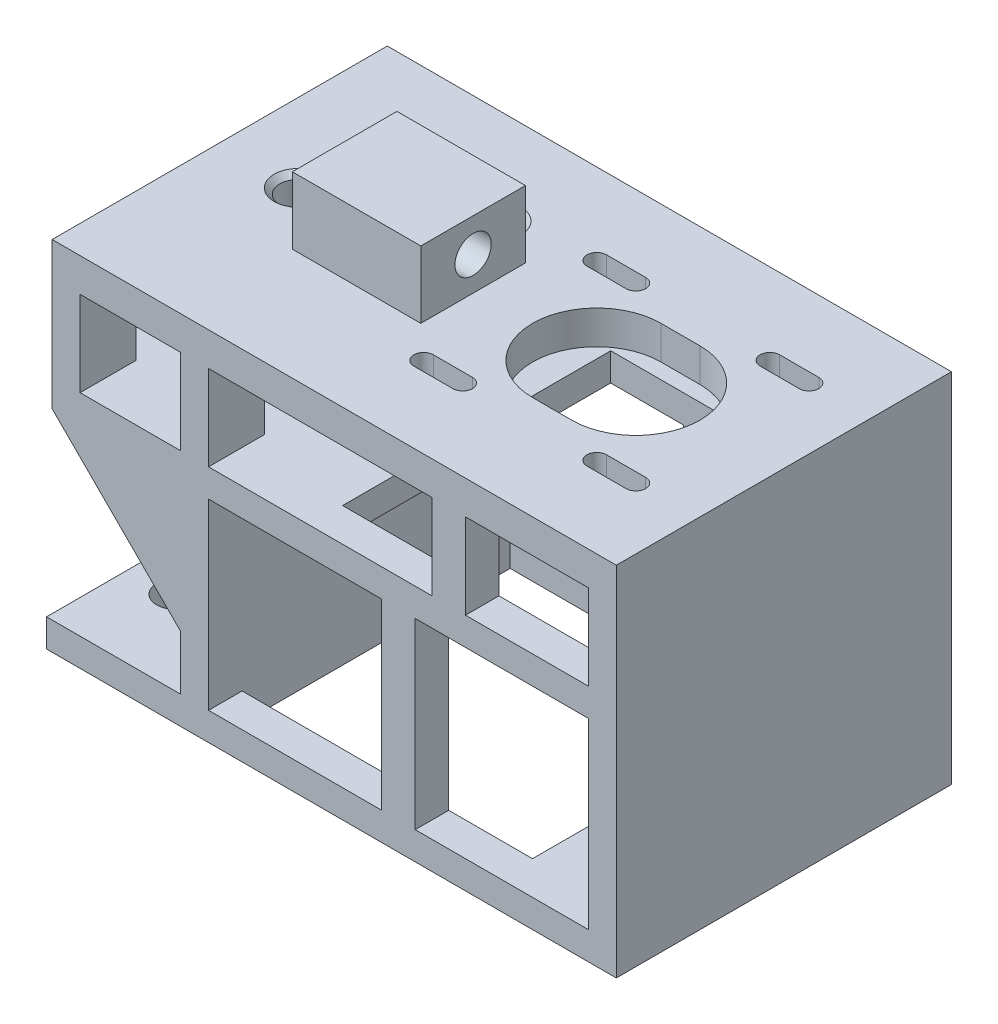
from build123d import *

# Parameters (mm, degrees)
SKETCH1_W           = 68
SKETCH1_H           = 15.25
SKETCH1_W_2         = 18
BOSS_EXTRUDE1_DEPTH = 60
SKETCH2_W           = 40
SKETCH2_H           = 15.25
CUT_EXTRUDE1_DEPTH  = 122.264174429
CUT_EXTRUDE2_REACH  = 116.127
CUT_EXTRUDE3_REACH  = 123.264
SKETCH5_R           = 3.25
CUT_EXTRUDE4_REACH  = 105.714
SKETCH6_R           = 2.75
SKETCH7_R           = 2.75
CUT_EXTRUDE5_DEPTH  = 115.127122105
CUT_EXTRUDE6_REACH  = 116.127
SKETCH8_R           = 3.25
SKETCH9_W           = 23
SKETCH9_H           = 21.27
SKETCH9_H_2         = 20
CUT_EXTRUDE7_DEPTH  = 12
CHAMFER1_SIZE       = 1
CUT_EXTRUDE8_REACH  = 123.264
SKETCH10_R          = 3.3
SKETCH10_R_2        = 2.75
SKETCH11_R          = 3.25
CUT_EXTRUDE9_DEPTH  = 125.338248339
CHAMFER2_SIZE       = 1
SKETCH12_W          = 50
SKETCH12_H          = 48
CUT_EXTRUDE10_DEPTH = 5
SKETCH13_W          = 52
SKETCH13_H          = 6
BOSS_EXTRUDE2_DEPTH = 5
SKETCH14_W          = 6
SKETCH14_H          = 32.75
BOSS_EXTRUDE3_DEPTH = 6
SKETCH15_W          = 6
SKETCH15_H          = 15.25
BOSS_EXTRUDE4_DEPTH = 6
BOSS_EXTRUDE5_DEPTH = 10


with BuildPart() as part:
    # Sketch1 → Boss-Extrude1 (new body)
    with BuildSketch(Plane.XY):
        Polygon((0, 0), (-29, 0), (-29, 5), (-5, 5), (-5, 37.75), (-28, 37.75), (-28, 64), (-5, 64), (-5, 76), (18, 76), (18, 64), (73, 64), (73, 0), (52, 0), (52, 5), (68, 5), (68, 37.75), (0, 37.75), align=None)
        with Locations((34, 50.375)):
            Rectangle(SKETCH1_W, SKETCH1_H, mode=Mode.SUBTRACT)
        with Locations((-14, 50.375)):
            Rectangle(SKETCH1_W_2, SKETCH1_H, mode=Mode.SUBTRACT)
    extrude(amount=BOSS_EXTRUDE1_DEPTH)

    # Sketch2 → Cut-Extrude1 (cut, through all)
    with BuildSketch(Plane(origin=(0, 0, 0), x_dir=(0, 0, -1), z_dir=(1, 0, 0))):
        with Locations((-30, 50.375)):
            Rectangle(SKETCH2_W, SKETCH2_H)
    extrude(amount=-CUT_EXTRUDE1_DEPTH, mode=Mode.SUBTRACT)

    # Sketch3 → Cut-Extrude2 (cut, up to next)
    with BuildSketch(Plane(origin=(0, 64, 0), x_dir=(1, 0, 0), z_dir=(0, 1, 0)), mode=Mode.PRIVATE) as cut_extrude2_sk1:
        with BuildLine():
            Line((39.5, -18.5), (46.5, -18.5))
            ThreePointArc((46.5, -18.5), (58, -30), (46.5, -41.5))
            Line((46.5, -41.5), (39.5, -41.5))
            ThreePointArc((39.5, -41.5), (28, -30), (39.5, -18.5))
        make_face()
    cut_extrude2_tool1 = extrude(cut_extrude2_sk1.sketch, amount=-CUT_EXTRUDE2_REACH, mode=Mode.PRIVATE) & part.part
    # Sketch3 → Cut-Extrude2 (cut, up to next)
    with BuildSketch(Plane(origin=(0, 64, 0), x_dir=(1, 0, 0), z_dir=(0, 1, 0)), mode=Mode.PRIVATE) as cut_extrude2_sk2:
        with BuildLine():
            Line((31, -16.25), (24, -16.25))
            ThreePointArc((24, -16.25), (22.25, -14.5), (24, -12.75))
            Line((24, -12.75), (31, -12.75))
            ThreePointArc((31, -12.75), (32.75, -14.5), (31, -16.25))
        make_face()
    cut_extrude2_tool2 = extrude(cut_extrude2_sk2.sketch, amount=-CUT_EXTRUDE2_REACH, mode=Mode.PRIVATE) & part.part
    # Sketch3 → Cut-Extrude2 (cut, up to next)
    with BuildSketch(Plane(origin=(0, 64, 0), x_dir=(1, 0, 0), z_dir=(0, 1, 0)), mode=Mode.PRIVATE) as cut_extrude2_sk3:
        with BuildLine():
            Line((55, -16.25), (62, -16.25))
            ThreePointArc((62, -16.25), (63.75, -14.5), (62, -12.75))
            Line((62, -12.75), (55, -12.75))
            ThreePointArc((55, -12.75), (53.25, -14.5), (55, -16.25))
        make_face()
    cut_extrude2_tool3 = extrude(cut_extrude2_sk3.sketch, amount=-CUT_EXTRUDE2_REACH, mode=Mode.PRIVATE) & part.part
    # Sketch3 → Cut-Extrude2 (cut, up to next)
    with BuildSketch(Plane(origin=(0, 64, 0), x_dir=(1, 0, 0), z_dir=(0, 1, 0)), mode=Mode.PRIVATE) as cut_extrude2_sk4:
        with BuildLine():
            Line((31, -43.75), (24, -43.75))
            ThreePointArc((24, -43.75), (22.25, -45.5), (24, -47.25))
            Line((24, -47.25), (31, -47.25))
            ThreePointArc((31, -47.25), (32.75, -45.5), (31, -43.75))
        make_face()
    cut_extrude2_tool4 = extrude(cut_extrude2_sk4.sketch, amount=-CUT_EXTRUDE2_REACH, mode=Mode.PRIVATE) & part.part
    # Sketch3 → Cut-Extrude2 (cut, up to next)
    with BuildSketch(Plane(origin=(0, 64, 0), x_dir=(1, 0, 0), z_dir=(0, 1, 0)), mode=Mode.PRIVATE) as cut_extrude2_sk5:
        with BuildLine():
            Line((55, -43.75), (62, -43.75))
            ThreePointArc((62, -43.75), (63.75, -45.5), (62, -47.25))
            Line((62, -47.25), (55, -47.25))
            ThreePointArc((55, -47.25), (53.25, -45.5), (55, -43.75))
        make_face()
    cut_extrude2_tool5 = extrude(cut_extrude2_sk5.sketch, amount=-CUT_EXTRUDE2_REACH, mode=Mode.PRIVATE) & part.part
    add(cut_extrude2_tool1.solids().sort_by_distance((43, 64, 30))[0], mode=Mode.SUBTRACT)
    add(cut_extrude2_tool2.solids().sort_by_distance((27.5, 64, 14.5))[0], mode=Mode.SUBTRACT)
    add(cut_extrude2_tool3.solids().sort_by_distance((58.5, 64, 14.5))[0], mode=Mode.SUBTRACT)
    add(cut_extrude2_tool4.solids().sort_by_distance((27.5, 64, 45.5))[0], mode=Mode.SUBTRACT)
    add(cut_extrude2_tool5.solids().sort_by_distance((58.5, 64, 45.5))[0], mode=Mode.SUBTRACT)

    # Sketch5 → Cut-Extrude3 (cut, up to next)
    with BuildSketch(Plane(origin=(0, 76, 0), x_dir=(1, 0, 0), z_dir=(0, 1, 0)), mode=Mode.PRIVATE) as cut_extrude3_sk1:
        with Locations(Location((9, -17.27, 0), (0, 0, 180))):
            Circle(SKETCH5_R)
    cut_extrude3_tool1 = extrude(cut_extrude3_sk1.sketch, amount=-CUT_EXTRUDE3_REACH, mode=Mode.PRIVATE) & part.part
    add(cut_extrude3_tool1.solids().sort_by_distance((9, 76, 17.27))[0], mode=Mode.SUBTRACT)

    # Sketch6 → Cut-Extrude4 (cut, up to next)
    with BuildSketch(Plane(origin=(0, 42.75, 0), x_dir=(1, 0, 0), z_dir=(0, 1, 0)), mode=Mode.PRIVATE) as cut_extrude4_sk1:
        with Locations(Location((9, -17.27, 0), (0, 0, 270))):
            Circle(SKETCH6_R)
    cut_extrude4_tool1 = extrude(cut_extrude4_sk1.sketch, amount=-CUT_EXTRUDE4_REACH, mode=Mode.PRIVATE) & part.part
    add(cut_extrude4_tool1.solids().sort_by_distance((9, 42.75, 17.27))[0], mode=Mode.SUBTRACT)

    # Sketch7 → Cut-Extrude5 (cut, through all)
    with BuildSketch(Plane(origin=(0, 64, 0), x_dir=(1, 0, 0), z_dir=(0, 1, 0))):
        with Locations(Location((-14, -30, 0), (0, 0, 270))):
            Circle(SKETCH7_R)
    extrude(amount=-CUT_EXTRUDE5_DEPTH, mode=Mode.SUBTRACT)

    # Sketch8 → Cut-Extrude6 (cut, up to next)
    with BuildSketch(Plane(origin=(0, 64, 0), x_dir=(1, 0, 0), z_dir=(0, 1, 0)), mode=Mode.PRIVATE) as cut_extrude6_sk1:
        with Locations(Location((-14, -30, 0), (0, 0, 270))):
            Circle(SKETCH8_R)
    cut_extrude6_tool1 = extrude(cut_extrude6_sk1.sketch, amount=-CUT_EXTRUDE6_REACH, mode=Mode.PRIVATE) & part.part
    add(cut_extrude6_tool1.solids().sort_by_distance((-14, 64, 30))[0], mode=Mode.SUBTRACT)

    # Sketch9 → Cut-Extrude7 (cut)
    with BuildSketch(Plane(origin=(0, 76, 0), x_dir=(1, 0, 0), z_dir=(0, 1, 0))):
        with Locations((6.5, -10.635)):
            Rectangle(SKETCH9_W, SKETCH9_H)
        with Locations((6.5, -50)):
            Rectangle(SKETCH9_W, SKETCH9_H_2)
    extrude(amount=-CUT_EXTRUDE7_DEPTH, mode=Mode.SUBTRACT)

    # Chamfer1
    # the kernel refuses this chamfer: 1 mm, written as the material it takes off along each edge
    with BuildSketch(Plane(origin=(-14, 64, 30), x_dir=(0, 0, 1), z_dir=(-1, 0, 0))) as chamfer1_piece_1:
        Polygon((3.25 + CHAMFER1_SIZE, 0), (3.25, -CHAMFER1_SIZE), (3.25, 0), align=None)
    revolve(axis=Axis((-14, 64, 30), (0, 1, 0)), mode=Mode.SUBTRACT)
    with BuildSketch(Plane(origin=(9, 64, 17.27), x_dir=(-1, 0, 0), z_dir=(0, 0, -1))) as chamfer1_piece_2_section:
        Polygon((3.25 + CHAMFER1_SIZE, 0), (3.25, -CHAMFER1_SIZE), (3.25, 0), align=None)
    chamfer1_piece_2 = revolve(axis=Axis((9, 64, 17.27), (0, 1, 0)), mode=Mode.PRIVATE)
    chamfer1_piece_2 = split(chamfer1_piece_2, bisect_by=Plane(origin=(12.733674615, 63.516325385, 21.27), z_dir=(0, 0, -1)), keep=Keep.TOP, mode=Mode.PRIVATE)
    add(chamfer1_piece_2, mode=Mode.SUBTRACT)

    # Sketch10 → Cut-Extrude8 (cut, up to next)
    with BuildSketch(Plane.XZ, mode=Mode.PRIVATE) as cut_extrude8_sk1:
        with Locations((-21, 45)):
            Circle(SKETCH10_R)
    cut_extrude8_tool1 = extrude(cut_extrude8_sk1.sketch, amount=-CUT_EXTRUDE8_REACH, mode=Mode.PRIVATE) & part.part
    # Sketch10 → Cut-Extrude8 (cut, up to next)
    with BuildSketch(Plane.XZ, mode=Mode.PRIVATE) as cut_extrude8_sk2:
        with Locations((-21, 15)):
            Circle(SKETCH10_R)
    cut_extrude8_tool2 = extrude(cut_extrude8_sk2.sketch, amount=-CUT_EXTRUDE8_REACH, mode=Mode.PRIVATE) & part.part
    # Sketch10 → Cut-Extrude8 (cut, up to next)
    with BuildSketch(Plane.XZ, mode=Mode.PRIVATE) as cut_extrude8_sk3:
        with Locations((60, 15)):
            Circle(SKETCH10_R_2)
    cut_extrude8_tool3 = extrude(cut_extrude8_sk3.sketch, amount=-CUT_EXTRUDE8_REACH, mode=Mode.PRIVATE) & part.part
    # Sketch10 → Cut-Extrude8 (cut, up to next)
    with BuildSketch(Plane.XZ, mode=Mode.PRIVATE) as cut_extrude8_sk4:
        with Locations((60, 45)):
            Circle(SKETCH10_R_2)
    cut_extrude8_tool4 = extrude(cut_extrude8_sk4.sketch, amount=-CUT_EXTRUDE8_REACH, mode=Mode.PRIVATE) & part.part
    add(cut_extrude8_tool1.solids().sort_by_distance((-21, 0, 45))[0], mode=Mode.SUBTRACT)
    add(cut_extrude8_tool2.solids().sort_by_distance((-21, 0, 15))[0], mode=Mode.SUBTRACT)
    add(cut_extrude8_tool3.solids().sort_by_distance((60, 0, 15))[0], mode=Mode.SUBTRACT)
    add(cut_extrude8_tool4.solids().sort_by_distance((60, 0, 45))[0], mode=Mode.SUBTRACT)

    # Sketch11 → Cut-Extrude9 (cut, through all)
    with BuildSketch(Plane.ZY.offset(5)):
        with Locations(Location((30.635, 70, 0), (0, 0, 270))):
            Circle(SKETCH11_R)
    extrude(amount=-CUT_EXTRUDE9_DEPTH, mode=Mode.SUBTRACT)

    # Chamfer2
    chamfer2_edges = [part.edges().sort_by_distance(p)[0] for p in [
        (-5, 73.25, 30.635),
    ]]
    chamfer(chamfer2_edges, length=CHAMFER2_SIZE)

    # Sketch12 → Cut-Extrude10 (cut)
    with BuildSketch(Plane(origin=(0, 42.75, 0), x_dir=(1, 0, 0), z_dir=(0, 1, 0))):
        with Locations((43, -30)):
            Rectangle(SKETCH12_W, SKETCH12_H)
    extrude(amount=-CUT_EXTRUDE10_DEPTH, mode=Mode.SUBTRACT)

    # Sketch13 → Boss-Extrude2 (add)
    with BuildSketch(Plane.XZ):
        with Locations((26, 57)):
            Rectangle(SKETCH13_W, SKETCH13_H)
        with Locations((26, 3)):
            Rectangle(SKETCH13_W, SKETCH13_H)
    extrude(amount=-BOSS_EXTRUDE2_DEPTH)

    # Sketch14 → Boss-Extrude3 (add)
    with BuildSketch(Plane.XY.offset(60)):
        with Locations((34, 21.375)):
            Rectangle(SKETCH14_W, SKETCH14_H)
    boss_extrude3 = extrude(amount=-BOSS_EXTRUDE3_DEPTH)

    # Sketch15 → Boss-Extrude4 (add)
    with BuildSketch(Plane.XY.offset(60)):
        with Locations((43, 50.375)):
            Rectangle(SKETCH15_W, SKETCH15_H)
    boss_extrude4 = extrude(amount=-BOSS_EXTRUDE4_DEPTH)

    # Mirror1: Boss-Extrude3, Boss-Extrude4 across plane
    add(boss_extrude3.mirror(Plane.XY.offset(30)))
    add(boss_extrude4.mirror(Plane.XY.offset(30)))

    # Sketch16 → Boss-Extrude5 (add)
    with BuildSketch(Plane.XY.offset(60)):
        Polygon((-28, 37.75), (-5, 14.75), (-5, 37.75), align=None)
    extrude(amount=-BOSS_EXTRUDE5_DEPTH)


solid = part.part
